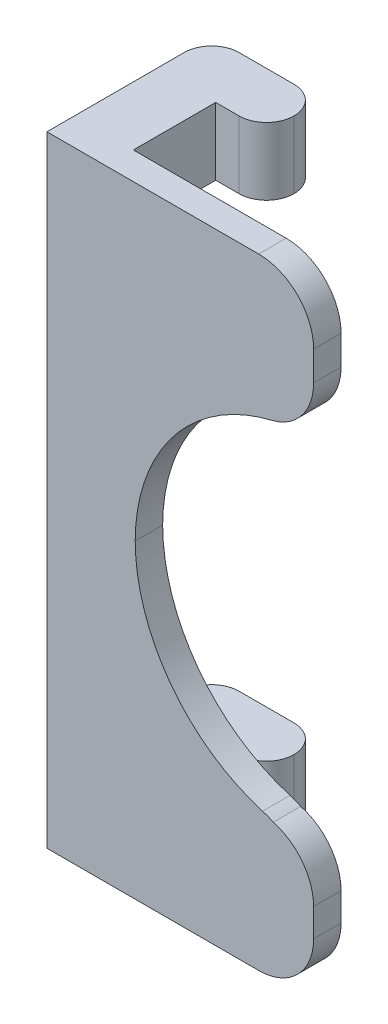
from build123d import *

# Parameters (mm, degrees)
BOSS_EXTRUDE1_DEPTH  = 1
FILLET1_START        = -1
FILLET1_DEPTH        = 3
FILLET2_START        = -1
FILLET2_DEPTH        = 3
SKETCH2_W            = 2.148941634
SKETCH2_H            = 2.454875289
BOSS_EXTRUDE2_DEPTH  = 4
SKETCH3_W            = 4
SKETCH3_H            = 2.454875289
BOSS_EXTRUDE3_DEPTH  = 2
FILLET3_R            = 1
FILLET3_OF_MIRROR1_R = 1
FILLET4_R            = 2


with BuildPart() as part:
    # Sketch1 → Boss-Extrude1 (new body)
    with BuildSketch(Plane.XY):
        with BuildLine():
            Line((50.566235294, -36.41094824), (50.566235294, -59.015823529))
            Line((50.566235294, -59.015823529), (60.281235294, -59.015823529))
            Line((60.281235294, -59.015823529), (60.281235294, -54.188823529))
            ThreePointArc((60.281235294, -54.188823529), (53.781235294, -47.688823529), (60.281235294, -41.188823529))
            Line((60.281235294, -41.188823529), (60.281235294, -36.41094824))
            Line((60.281235294, -36.41094824), (50.566235294, -36.41094824))
        make_face()
    boss_extrude1 = extrude(amount=BOSS_EXTRUDE1_DEPTH)

    # Fillet1: read off the stored shape, not the designer's step
    # Fillet1 outline → Fillet1 (cut)
    with BuildSketch(Plane.XY.offset(FILLET1_START)):
        with BuildLine():
            ThreePointArc((60.281235294, -54.188823529), (59.341877232, -54.12058895), (58.422241232, -53.917317816))
            add(Edge.make_bspline(
                [(58.422241232, -53.917317816), (59.442487987, -54.221826831), (60.281235188, -55.09507753), (60.281235294, -56.412193512)],
                knots=[0, 0, 0, 0, 0.45799037, 0.45799037, 0.45799037, 0.45799037], degree=3, weights=[1, 0.738797902, 0.597223849, 0.575277842]))
            Line((60.281235294, -56.412193512), (60.281235294, -54.188823529))
        make_face()
        with BuildLine():
            Line((60.281235294, -59.015823529), (60.281235294, -56.412193512))
            add(Edge.make_bspline(
                [(60.281235294, -56.412193512), (60.28123543, -58.106912276), (59.025045045, -59.01582353), (57.677605485, -59.015823529)],
                knots=[0.45799037, 0.45799037, 0.45799037, 0.45799037, 1, 1, 1, 1], degree=3, weights=[0.575277842, 0.549305795, 0.690879848, 1]))
            Line((57.677605485, -59.015823529), (60.281235294, -59.015823529))
        make_face()
    extrude(amount=FILLET1_DEPTH, mode=Mode.SUBTRACT)

    # Fillet2: read off the stored shape, not the designer's step
    # Fillet2 outline → Fillet2 (cut)
    with BuildSketch(Plane.XY.offset(FILLET2_START)):
        with BuildLine():
            Line((60.281235294, -36.41094824), (57.705740699, -36.41094824))
            add(Edge.make_bspline(
                [(57.705740699, -36.41094824), (59.038271524, -36.41094824), (60.281235294, -37.309720888), (60.281235294, -38.986442835)],
                knots=[0, 0, 0, 0, 0.541625397, 0.541625397, 0.541625397, 0.541625397], degree=3, weights=[1, 0.690686422, 0.548904933, 0.574655534]))
            Line((60.281235294, -38.986442835), (60.281235294, -36.41094824))
        make_face()
        with BuildLine():
            Line((60.281235294, -41.188823529), (60.281235294, -38.986442835))
            add(Edge.make_bspline(
                [(60.281235294, -38.986442835), (60.281235295, -40.292334143), (59.448338906, -41.156634612), (58.436628954, -41.456053082)],
                knots=[0.541625397, 0.541625397, 0.541625397, 0.541625397, 1, 1, 1, 1], degree=3, weights=[0.574655534, 0.596448126, 0.738229615, 1]))
            ThreePointArc((58.436628954, -41.456053082), (59.349303941, -41.255977817), (60.281235294, -41.188823529))
        make_face()
    extrude(amount=FILLET2_DEPTH, mode=Mode.SUBTRACT)

    # Sketch2 → Boss-Extrude2 (add)
    with BuildSketch(Plane.XY.offset(1)):
        with Locations((51.640706111, -37.638385885)):
            Rectangle(SKETCH2_W, SKETCH2_H)
    boss_extrude2 = extrude(amount=-BOSS_EXTRUDE2_DEPTH)

    # Sketch3 → Boss-Extrude3 (add)
    with BuildSketch(Plane(origin=(0, 0, -3), x_dir=(-1, 0, 0), z_dir=(0, 0, -1))):
        with Locations((-52.566235294, -37.638385885)):
            Rectangle(SKETCH3_W, SKETCH3_H)
    boss_extrude3 = extrude(amount=BOSS_EXTRUDE3_DEPTH)

    # Fillet3
    fillet3_edges = [part.edges().sort_by_distance(p)[0] for p in [
        (54.566235294, -37.638385885, -3),
        (54.566235294, -37.638385885, -5),
        (50.566235294, -37.638385885, -5),
    ]]
    fillet(fillet3_edges, radius=FILLET3_R - 0.0001)  # a hair under: the kernel refuses the full size

    # Mirror1: Boss-Extrude1, Boss-Extrude2, Boss-Extrude3 across plane
    add(boss_extrude1.mirror(Plane.ZX.offset(-47.713385885)))
    add(boss_extrude2.mirror(Plane.ZX.offset(-47.713385885)))
    add(boss_extrude3.mirror(Plane.ZX.offset(-47.713385885)))

    # Fillet3 of Mirror1
    fillet3_of_mirror1_edges = [part.edges().sort_by_distance(p)[0] for p in [
        (54.566235294, -57.788385885, -3),
        (54.566235294, -57.788385885, -5),
        (50.566235294, -57.788385885, -5),
    ]]
    fillet(fillet3_of_mirror1_edges, radius=FILLET3_OF_MIRROR1_R - 0.0001)  # a hair under: the kernel refuses the full size

    # Fillet4
    # the kernel refuses this fillet: 2 mm, written as the material it takes off along each edge
    with BuildSketch(Plane(origin=(60.281235294, -41.23794824, -4.403389552), x_dir=(0, 1, 0), z_dir=(0, 0, 1))) as fillet4_piece_1:
        with BuildLine():
            CenterArc((1.761355821, 2), FILLET4_R, 193.608960631, 76.391039369)
            Line((-0.182492608, 1.529411765), (-0.221369576, 1.52))
            ThreePointArc((-0.221369576, 1.52), (-0.085502649, 0.765391227), (-0.04, 0))
            Line((-0.04, 0), (0, -0.04))
            Line((0, -0.04), (1.761355821, -0.04))
            Line((1.761355821, -0.04), (1.761355821, 0))
        make_face()
    extrude(amount=9.806779105, mode=Mode.SUBTRACT)
    with BuildSketch(Plane(origin=(60.281235294, -36.41094824, -5), x_dir=(-1, 0, 0), z_dir=(0, 0, 1))) as fillet4_piece_2:
        with BuildLine():
            CenterArc((FILLET4_R, FILLET4_R), FILLET4_R, 180, 90)
            Line((0, FILLET4_R), (-FILLET4_R * 0.02, FILLET4_R))
            Line((-FILLET4_R * 0.02, FILLET4_R), (-FILLET4_R * 0.02, -FILLET4_R * 0.02))
            Line((-FILLET4_R * 0.02, -FILLET4_R * 0.02), (FILLET4_R, -FILLET4_R * 0.02))
            Line((FILLET4_R, -FILLET4_R * 0.02), (FILLET4_R, 0))
        make_face()
    extrude(amount=11, mode=Mode.SUBTRACT)
    with BuildSketch(Plane(origin=(60.281235294, -59.015823529, -5), x_dir=(-1, 0, 0), z_dir=(0, 0, 1))) as fillet4_piece_3:
        with BuildLine():
            CenterArc((FILLET4_R, -FILLET4_R), FILLET4_R, 90, 90)
            Line((0, -FILLET4_R), (-FILLET4_R * 0.02, -FILLET4_R))
            Line((-FILLET4_R * 0.02, -FILLET4_R), (-FILLET4_R * 0.02, FILLET4_R * 0.02))
            Line((-FILLET4_R * 0.02, FILLET4_R * 0.02), (FILLET4_R, FILLET4_R * 0.02))
            Line((FILLET4_R, FILLET4_R * 0.02), (FILLET4_R, 0))
        make_face()
    extrude(amount=11, mode=Mode.SUBTRACT)
    with BuildSketch(Plane(origin=(60.281235294, -54.23794824, -4.399691242), x_dir=(0, -1, 0), z_dir=(0, 0, 1))) as fillet4_piece_4:
        with BuildLine():
            CenterArc((1.759876497, -2), FILLET4_R, 90, 74.48871178)
            Line((-0.167279071, -1.465143556), (-0.205822183, -1.454446427))
            ThreePointArc((-0.205822183, -1.454446427), (-0.081696985, -0.732793564), (-0.04, 0))
            Line((-0.04, 0), (0, 0.04))
            Line((0, 0.04), (1.759876497, 0.04))
            Line((1.759876497, 0.04), (1.759876497, 0))
        make_face()
    extrude(amount=9.799382485, mode=Mode.SUBTRACT)


solid = part.part
